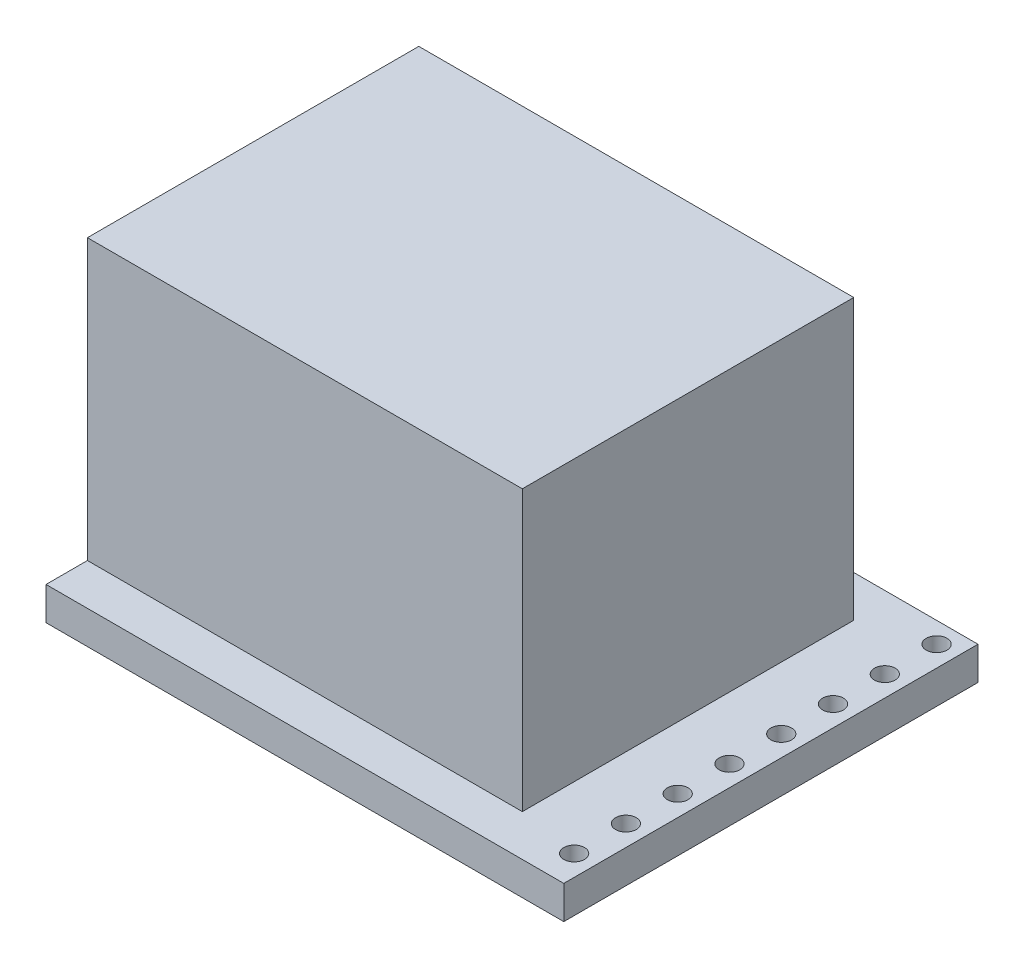
from build123d import *

# Parameters (mm, degrees)
SKETCH1_W           = 25
SKETCH1_H           = 20
BOSS_EXTRUDE1_DEPTH = 1.6
SKETCH2_W           = 21
SKETCH2_H           = 16
BOSS_EXTRUDE2_DEPTH = 13.5
CUT_EXTRUDE1_DEPTH  = 13.5
SKETCH4_R           = 0.5
CUT_EXTRUDE2_DEPTH  = 13.5
BOSS_EXTRUDE3_DEPTH = 2
SKETCH6_R           = 1.5
BOSS_EXTRUDE4_DEPTH = 2


with BuildPart() as part:
    # Sketch1 → Boss-Extrude1 (new body)
    with BuildSketch(Plane(origin=(0, 0, 0), x_dir=(1, 0, 0), z_dir=(0, 1, 0))):
        Rectangle(SKETCH1_W, SKETCH1_H)
    extrude(amount=-BOSS_EXTRUDE1_DEPTH)

    # Sketch2 → Boss-Extrude2 (add)
    with BuildSketch(Plane(origin=(0, 0, 0), x_dir=(1, 0, 0), z_dir=(0, 1, 0))):
        with Locations((-2, 0)):
            Rectangle(SKETCH2_W, SKETCH2_H)
    extrude(amount=BOSS_EXTRUDE2_DEPTH)

    # Sketch3 → Cut-Extrude1 (cut)
    with BuildSketch(Plane.ZY.offset(12.5)):
        Polygon((-6.2, 3.75), (-3.5, 3.75), (-3.5, 2.25), (3.5, 2.25), (3.5, 3.75), (6.2, 3.75), (6.2, 10.75), (-6.2, 10.75), align=None)
    extrude(amount=-CUT_EXTRUDE1_DEPTH, mode=Mode.SUBTRACT)

    # Sketch4 → Cut-Extrude2 (cut)
    with BuildSketch(Plane(origin=(0, 0, 0), x_dir=(1, 0, 0), z_dir=(0, 1, 0))):
        with Locations((11.5, 9)):
            Circle(SKETCH4_R)
        with Locations((11.5, 6.5)):
            Circle(SKETCH4_R)
        with Locations((11.5, 4)):
            Circle(SKETCH4_R)
        with Locations((11.5, 1.5)):
            Circle(SKETCH4_R)
        with Locations((11.5, -1)):
            Circle(SKETCH4_R)
        with Locations((11.5, -3.5)):
            Circle(SKETCH4_R)
        with Locations((11.5, -6)):
            Circle(SKETCH4_R)
        with Locations((11.5, -8.5)):
            Circle(SKETCH4_R)
    extrude(amount=-CUT_EXTRUDE2_DEPTH, mode=Mode.SUBTRACT)

    # Sketch5 → Boss-Extrude3 (add)
    with BuildSketch(Plane(origin=(0, -1.6, 0), x_dir=(-1, 0, 0), z_dir=(0, -1, 0))):
        with BuildLine():
            Line((-8.5, -4), (-8.5, 4))
            ThreePointArc((-8.5, 4), (-6.5, 6), (-4.5, 4))
            Line((-4.5, 4), (-4.5, -4))
            ThreePointArc((-4.5, -4), (-6.5, -6), (-8.5, -4))
        make_face()
    extrude(amount=BOSS_EXTRUDE3_DEPTH)

    # Sketch6 → Boss-Extrude4 (add)
    with BuildSketch(Plane.XZ.offset(1.6)):
        with Locations((-2.5, 6)):
            Circle(SKETCH6_R)
        with Locations((-2.5, -6)):
            Circle(SKETCH6_R)
    extrude(amount=BOSS_EXTRUDE4_DEPTH)


solid = part.part
